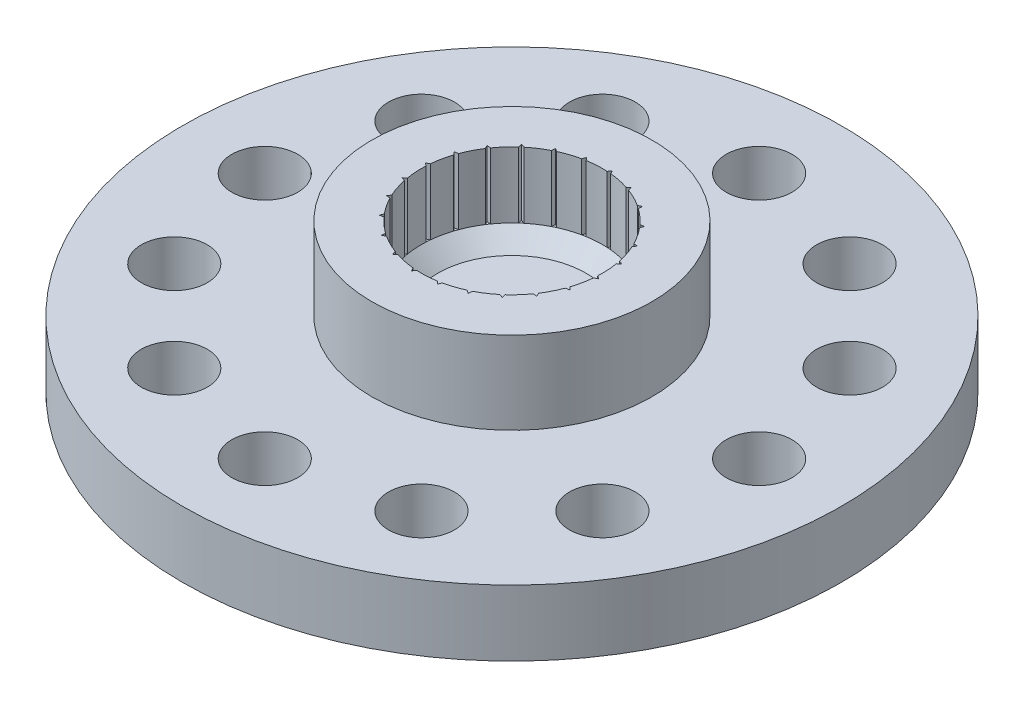
from build123d import *

# Parameters (mm, degrees)
SKETCH1_R           = 10
BOSS_EXTRUDE1_DEPTH = 2
SKETCH2_R           = 4.25
BOSS_EXTRUDE2_DEPTH = 2.5
CAVITY4_START       = 2.5
CAVITY4_DEPTH       = 2
SKETCH3_R           = 1
CUT_EXTRUDE1_DEPTH  = 15.361406616
CIRPATTERN1_COUNT   = 12


with BuildPart() as part:
    # Sketch1 → Boss-Extrude1 (new body)
    with BuildSketch(Plane(origin=(0, 0, 0), x_dir=(1, 0, 0), z_dir=(0, 1, 0))):
        with Locations(Location((0, 0, 0), (0, 0, 270))):
            Circle(SKETCH1_R)
    extrude(amount=BOSS_EXTRUDE1_DEPTH)

    # Sketch2 → Boss-Extrude2 (add)
    with BuildSketch(Plane(origin=(0, 2, 0), x_dir=(1, 0, 0), z_dir=(0, 1, 0))):
        with Locations(Location((0, 0, 0), (0, 0, 270))):
            Circle(SKETCH2_R)
    extrude(amount=BOSS_EXTRUDE2_DEPTH)

    # Cavity4: read off the stored shape, not the designer's step
    # Cavity4 outline → Cavity4 (cut)
    with BuildSketch(Plane(origin=(0, 0, 0), x_dir=(1, 0, 0), z_dir=(0, 1, 0)).offset(CAVITY4_START)):
        with BuildLine():
            Line((-0.937311647, -2.691458132), (-0.849363871, -2.615546026))
            ThreePointArc((-0.849363871, -2.615546026), (-0.557706787, -2.692854088), (-0.259335807, -2.737744498))
            Line((-0.259335807, -2.737744498), (-0.208772903, -2.842343026))
            Line((-0.208772903, -2.842343026), (-0.143469374, -2.746255003))
            ThreePointArc((-0.143469374, -2.746255003), (0.158258534, -2.745442448), (0.458081263, -2.711579163))
            Line((0.458081263, -2.711579163), (0.533993369, -2.799526939))
            Line((0.533993369, -2.799526939), (0.572202324, -2.689811239))
            ThreePointArc((0.572202324, -2.689811239), (0.863438798, -2.610933443), (1.144280852, -2.500624188))
            Line((1.144280852, -2.500624188), (1.240368875, -2.565927718))
            Line((1.240368875, -2.565927718), (1.248879379, -2.450061284))
            ThreePointArc((1.248879379, -2.450061284), (1.509777135, -2.298493638), (1.752499592, -2.119255808))
            Line((1.752499592, -2.119255808), (1.862215292, -2.157464763))
            Line((1.862215292, -2.157464763), (1.840447368, -2.043343702))
            ThreePointArc((1.840447368, -2.043343702), (2.053226655, -1.82941529), (2.241288381, -1.593463647))
            Line((2.241288381, -1.593463647), (2.357154815, -1.601974151))
            Line((2.357154815, -1.601974151), (2.306591911, -1.497375623))
            ThreePointArc((2.306591911, -1.497375623), (2.456752172, -1.235665313), (2.577337071, -0.959079571))
            Line((2.577337071, -0.959079571), (2.691458132, -0.937311647))
            Line((2.691458132, -0.937311647), (2.615546026, -0.849363871))
            ThreePointArc((2.615546026, -0.849363871), (2.692854088, -0.557706787), (2.737744498, -0.259335807))
            Line((2.737744498, -0.259335807), (2.842343026, -0.208772903))
            Line((2.842343026, -0.208772903), (2.746255003, -0.143469374))
            ThreePointArc((2.746255003, -0.143469374), (2.745442448, 0.158258534), (2.711579163, 0.458081263))
            Line((2.711579163, 0.458081263), (2.799526939, 0.533993369))
            Line((2.799526939, 0.533993369), (2.689811239, 0.572202324))
            ThreePointArc((2.689811239, 0.572202324), (2.610933443, 0.863438798), (2.500624188, 1.144280852))
            Line((2.500624188, 1.144280852), (2.565927718, 1.240368875))
            Line((2.565927718, 1.240368875), (2.450061284, 1.248879379))
            ThreePointArc((2.450061284, 1.248879379), (2.298493638, 1.509777135), (2.119255808, 1.752499592))
            Line((2.119255808, 1.752499592), (2.157464763, 1.862215292))
            Line((2.157464763, 1.862215292), (2.043343702, 1.840447368))
            ThreePointArc((2.043343702, 1.840447368), (1.82941529, 2.053226655), (1.593463647, 2.241288381))
            Line((1.593463647, 2.241288381), (1.601974151, 2.357154815))
            Line((1.601974151, 2.357154815), (1.497375623, 2.306591911))
            ThreePointArc((1.497375623, 2.306591911), (1.235665313, 2.456752172), (0.959079571, 2.577337071))
            Line((0.959079571, 2.577337071), (0.937311647, 2.691458132))
            Line((0.937311647, 2.691458132), (0.849363871, 2.615546026))
            ThreePointArc((0.849363871, 2.615546026), (0.557706787, 2.692854088), (0.259335807, 2.737744498))
            Line((0.259335807, 2.737744498), (0.208772903, 2.842343026))
            Line((0.208772903, 2.842343026), (0.143469374, 2.746255003))
            ThreePointArc((0.143469374, 2.746255003), (-0.158258534, 2.745442448), (-0.458081263, 2.711579163))
            Line((-0.458081263, 2.711579163), (-0.533993369, 2.799526939))
            Line((-0.533993369, 2.799526939), (-0.572202324, 2.689811239))
            ThreePointArc((-0.572202324, 2.689811239), (-0.863438798, 2.610933443), (-1.144280852, 2.500624188))
            Line((-1.144280852, 2.500624188), (-1.240368875, 2.565927718))
            Line((-1.240368875, 2.565927718), (-1.248879379, 2.450061284))
            ThreePointArc((-1.248879379, 2.450061284), (-1.509777135, 2.298493638), (-1.752499592, 2.119255808))
            Line((-1.752499592, 2.119255808), (-1.862215292, 2.157464763))
            Line((-1.862215292, 2.157464763), (-1.840447368, 2.043343702))
            ThreePointArc((-1.840447368, 2.043343702), (-2.053226655, 1.82941529), (-2.241288381, 1.593463647))
            Line((-2.241288381, 1.593463647), (-2.357154815, 1.601974151))
            Line((-2.357154815, 1.601974151), (-2.306591911, 1.497375623))
            ThreePointArc((-2.306591911, 1.497375623), (-2.456752172, 1.235665313), (-2.577337071, 0.959079571))
            Line((-2.577337071, 0.959079571), (-2.691458132, 0.937311647))
            Line((-2.691458132, 0.937311647), (-2.615546026, 0.849363871))
            ThreePointArc((-2.615546026, 0.849363871), (-2.692854088, 0.557706787), (-2.737744498, 0.259335807))
            Line((-2.737744498, 0.259335807), (-2.842343026, 0.208772903))
            Line((-2.842343026, 0.208772903), (-2.746255003, 0.143469374))
            ThreePointArc((-2.746255003, 0.143469374), (-2.745442448, -0.158258534), (-2.711579163, -0.458081263))
            Line((-2.711579163, -0.458081263), (-2.799526939, -0.533993369))
            Line((-2.799526939, -0.533993369), (-2.689811239, -0.572202324))
            ThreePointArc((-2.689811239, -0.572202324), (-2.610933443, -0.863438798), (-2.500624188, -1.144280852))
            Line((-2.500624188, -1.144280852), (-2.565927718, -1.240368875))
            Line((-2.565927718, -1.240368875), (-2.450061284, -1.248879379))
            ThreePointArc((-2.450061284, -1.248879379), (-2.298493638, -1.509777135), (-2.119255808, -1.752499592))
            Line((-2.119255808, -1.752499592), (-2.157464763, -1.862215292))
            Line((-2.157464763, -1.862215292), (-2.043343702, -1.840447368))
            ThreePointArc((-2.043343702, -1.840447368), (-1.82941529, -2.053226655), (-1.593463647, -2.241288381))
            Line((-1.593463647, -2.241288381), (-1.601974151, -2.357154815))
            Line((-1.601974151, -2.357154815), (-1.497375623, -2.306591911))
            ThreePointArc((-1.497375623, -2.306591911), (-1.235665313, -2.456752172), (-0.959079571, -2.577337071))
            Line((-0.959079571, -2.577337071), (-0.937311647, -2.691458132))
        make_face()
    extrude(amount=CAVITY4_DEPTH, mode=Mode.SUBTRACT)

    # Cavity4 2 outline → Cavity4 2 (revolve, cut)
    with BuildSketch(Plane.XY):
        Polygon((0, 2.5), (0, 2), (2.25, 2), (2.75, 2.5), align=None)
    revolve(axis=Axis((0, 0, 0), (0, 1, 0)), mode=Mode.SUBTRACT)

    # Sketch3 → Cut-Extrude1 (cut, through all)
    with BuildSketch(Plane(origin=(0, 2, 0), x_dir=(1, 0, 0), z_dir=(0, 1, 0))):
        with Locations(Location((0, 7.5, 0), (0, 0, 270))):
            Circle(SKETCH3_R)
    cut_extrude1 = extrude(amount=-CUT_EXTRUDE1_DEPTH, mode=Mode.SUBTRACT)

    # CirPattern1: Cut-Extrude1 ×12 about axis
    cirpattern1_axis = Axis((0, 0, 0), (0, 1, 0))
    for i in range(1, CIRPATTERN1_COUNT):
        add(cut_extrude1.rotate(cirpattern1_axis, i * 360 / CIRPATTERN1_COUNT), mode=Mode.SUBTRACT)


solid = part.part
